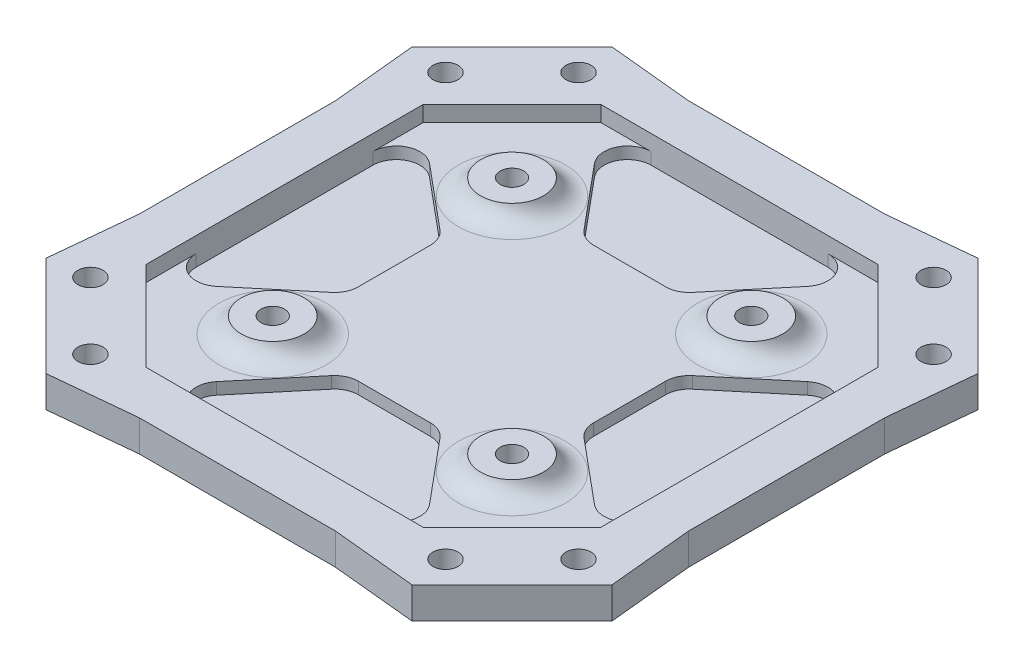
from build123d import *

# Parameters (mm, degrees)
BOSS_EXTRUDE1_DEPTH = 4
SKETCH2_R           = 1.6
CUT_EXTRUDE1_DEPTH  = 80.797158741
CUT_EXTRUDE2_DEPTH  = 2
CUT_EXTRUDE3_DEPTH  = 1.5
SKETCH5_R           = 4
BOSS_EXTRUDE3_DEPTH = 2
SKETCH6_R           = 1.5
CUT_EXTRUDE4_DEPTH  = 80.797158741
FILLET1_R           = 3


with BuildPart() as part:
    # Sketch1 → Boss-Extrude1 (new body)
    with BuildSketch(Plane(origin=(0, 0, 0), x_dir=(1, 0, 0), z_dir=(0, 1, 0))):
        Polygon((-12.5, 0), (12.5, 0), (23.338026386, 1.062677778), (36.065948447, -11.665244283), (35.003270669, -22.503270669), (35.003270669, -47.503270669), (36.065948447, -58.341297055), (23.338026386, -71.069219116), (12.5, -70.006541338), (-12.5, -70.006541338), (-23.338026386, -71.069219116), (-36.065948447, -58.341297055), (-35.003270669, -47.503270669), (-35.003270669, -22.503270669), (-36.065948447, -11.665244283), (-23.338026386, 1.062677778), align=None)
    extrude(amount=BOSS_EXTRUDE1_DEPTH)

    # Sketch2 → Cut-Extrude1 (cut, through all)
    with BuildSketch(Plane(origin=(0, 4, 0), x_dir=(1, 0, 0), z_dir=(0, 1, 0))):
        with Locations(Location((22.63, -3.893270669, 0), (0, 0, 270))):
            Circle(SKETCH2_R)
        with Locations(Location((31.11, -12.373270669, 0), (0, 0, 270))):
            Circle(SKETCH2_R)
        with Locations(Location((-31.11, -12.373270669, 0), (0, 0, 90))):
            Circle(SKETCH2_R)
        with Locations(Location((-22.63, -3.893270669, 0), (0, 0, 90))):
            Circle(SKETCH2_R)
        with Locations(Location((31.11, -57.633270669, 0), (0, 0, 90))):
            Circle(SKETCH2_R)
        with Locations(Location((22.63, -66.113270669, 0), (0, 0, 90))):
            Circle(SKETCH2_R)
        with Locations(Location((-22.63, -66.113270669, 0), (0, 0, 270))):
            Circle(SKETCH2_R)
        with Locations(Location((-31.11, -57.633270669, 0), (0, 0, 270))):
            Circle(SKETCH2_R)
    extrude(amount=-CUT_EXTRUDE1_DEPTH, mode=Mode.SUBTRACT)

    # Sketch3 → Cut-Extrude2 (cut)
    with BuildSketch(Plane(origin=(0, 4, 0), x_dir=(1, 0, 0), z_dir=(0, 1, 0))):
        Polygon((-17.672782103, -6), (17.672782103, -6), (29.003270669, -17.330488566), (29.003270669, -52.676052772), (17.672782103, -64.006541338), (-17.672782103, -64.006541338), (-29.003270669, -52.676052772), (-29.003270669, -17.330488566), align=None)
    extrude(amount=-CUT_EXTRUDE2_DEPTH, mode=Mode.SUBTRACT)

    # Sketch4 → Cut-Extrude3 (cut)
    with BuildSketch(Plane(origin=(0, 2, 0), x_dir=(1, 0, 0), z_dir=(0, 1, 0))):
        with BuildLine():
            Line((-4.595346553, -50.006541338), (4.595346553, -50.006541338))
            ThreePointArc((4.595346553, -50.006541338), (5.867462624, -50.289609115), (6.899515315, -51.085394202))
            Line((6.899515315, -51.085394202), (13.569676517, -59.085394202))
            ThreePointArc((13.569676517, -59.085394202), (13.982439977, -62.278657408), (11.265507754, -64.006541338))
            Line((11.265507754, -64.006541338), (-11.265507754, -64.006541338))
            ThreePointArc((-11.265507754, -64.006541338), (-13.982439977, -62.278657408), (-13.569676517, -59.085394202))
            Line((-13.569676517, -59.085394202), (-6.899515315, -51.085394202))
            ThreePointArc((-6.899515315, -51.085394202), (-5.867462624, -50.289609115), (-4.595346553, -50.006541338))
        make_face()
        with BuildLine():
            Line((-24.082123534, -48.572947186), (-16.082123534, -41.902785984))
            ThreePointArc((-16.082123534, -41.902785984), (-15.286338446, -40.870733292), (-15.003270669, -39.598617222))
            Line((-15.003270669, -39.598617222), (-15.003270669, -30.407924116))
            ThreePointArc((-15.003270669, -30.407924116), (-15.286338446, -29.135808045), (-16.082123534, -28.103755354))
            Line((-16.082123534, -28.103755354), (-24.082123534, -21.433594152))
            ThreePointArc((-24.082123534, -21.433594152), (-27.27538674, -21.020830692), (-29.003270669, -23.737762914))
            Line((-29.003270669, -23.737762914), (-29.003270669, -46.268778423))
            ThreePointArc((-29.003270669, -46.268778423), (-27.27538674, -48.985710646), (-24.082123534, -48.572947186))
        make_face()
        with BuildLine():
            Line((-13.569676517, -10.921147135), (-6.899515315, -18.921147135))
            ThreePointArc((-6.899515315, -18.921147135), (-5.867462624, -19.716932223), (-4.595346553, -20))
            Line((-4.595346553, -20), (4.595346553, -20))
            ThreePointArc((4.595346553, -20), (5.867462624, -19.716932223), (6.899515315, -18.921147135))
            Line((6.899515315, -18.921147135), (13.569676517, -10.921147135))
            ThreePointArc((13.569676517, -10.921147135), (13.982439977, -7.727883929), (11.265507754, -6))
            Line((11.265507754, -6), (-11.265507754, -6))
            ThreePointArc((-11.265507754, -6), (-13.982439977, -7.727883929), (-13.569676517, -10.921147135))
        make_face()
        with BuildLine():
            Line((24.082123534, -21.433594152), (16.082123534, -28.103755354))
            ThreePointArc((16.082123534, -28.103755354), (15.286338446, -29.135808045), (15.003270669, -30.407924116))
            Line((15.003270669, -30.407924116), (15.003270669, -39.598617222))
            ThreePointArc((15.003270669, -39.598617222), (15.286338446, -40.870733292), (16.082123534, -41.902785984))
            Line((16.082123534, -41.902785984), (24.082123534, -48.572947186))
            ThreePointArc((24.082123534, -48.572947186), (27.27538674, -48.985710646), (29.003270669, -46.268778423))
            Line((29.003270669, -46.268778423), (29.003270669, -23.737762914))
            ThreePointArc((29.003270669, -23.737762914), (27.27538674, -21.020830692), (24.082123534, -21.433594152))
        make_face()
    extrude(amount=-CUT_EXTRUDE3_DEPTH, mode=Mode.SUBTRACT)

    # Sketch5 → Boss-Extrude3 (add)
    with BuildSketch(Plane(origin=(0, 2, 0), x_dir=(1, 0, 0), z_dir=(0, 1, 0))):
        with Locations(Location((15.25, -19.753270669, 0), (0, 0, 90))):
            Circle(SKETCH5_R)
        with Locations(Location((-15.25, -19.753270669, 0), (0, 0, 90))):
            Circle(SKETCH5_R)
        with Locations(Location((-15.25, -50.253270669, 0), (0, 0, 90))):
            Circle(SKETCH5_R)
        with Locations(Location((15.25, -50.253270669, 0), (0, 0, 90))):
            Circle(SKETCH5_R)
    extrude(amount=BOSS_EXTRUDE3_DEPTH)

    # Sketch6 → Cut-Extrude4 (cut, through all)
    with BuildSketch(Plane(origin=(0, 4, 0), x_dir=(1, 0, 0), z_dir=(0, 1, 0))):
        with Locations(Location((15.25, -19.753270669, 0), (0, 0, 270))):
            Circle(SKETCH6_R)
        with Locations(Location((15.25, -50.253270669, 0), (0, 0, 270))):
            Circle(SKETCH6_R)
        with Locations(Location((-15.25, -50.253270669, 0), (0, 0, 270))):
            Circle(SKETCH6_R)
        with Locations(Location((-15.25, -19.753270669, 0), (0, 0, 270))):
            Circle(SKETCH6_R)
    extrude(amount=-CUT_EXTRUDE4_DEPTH, mode=Mode.SUBTRACT)

    # Fillet1
    # the kernel refuses this fillet: 3 mm, written as the material it adds along each edge
    with BuildSketch(Plane(origin=(15.25, 2, 19.753270669), x_dir=(0, 0, -1), z_dir=(1, 0, 0))) as fillet1_piece_1:
        with BuildLine():
            CenterArc((6.828427125, 3), FILLET1_R, 199.471220634, 70.528779366)
            Line((4, 2), (3.943431458, 1.98))
            ThreePointArc((3.943431458, 1.98), (3.94, 1), (3.94, 0))
            Line((3.94, 0), (4, -0.06))
            Line((4, -0.06), (6.828427125, -0.06))
            Line((6.828427125, -0.06), (6.828427125, 0))
        make_face()
    revolve(axis=Axis((15.25, 2, 19.753270669), (0, 1, 0)))
    with BuildSketch(Plane(origin=(-15.25, 2, 19.753270669), x_dir=(0, 0, -1), z_dir=(1, 0, 0))) as fillet1_piece_2:
        with BuildLine():
            CenterArc((6.828427125, 3), FILLET1_R, 199.471220634, 70.528779366)
            Line((4, 2), (3.943431458, 1.98))
            ThreePointArc((3.943431458, 1.98), (3.94, 1), (3.94, 0))
            Line((3.94, 0), (4, -0.06))
            Line((4, -0.06), (6.828427125, -0.06))
            Line((6.828427125, -0.06), (6.828427125, 0))
        make_face()
    revolve(axis=Axis((-15.25, 2, 19.753270669), (0, 1, 0)))
    with BuildSketch(Plane(origin=(-15.25, 2, 50.253270669), x_dir=(0, 0, -1), z_dir=(1, 0, 0))) as fillet1_piece_3:
        with BuildLine():
            CenterArc((6.828427125, 3), FILLET1_R, 199.471220634, 70.528779366)
            Line((4, 2), (3.943431458, 1.98))
            ThreePointArc((3.943431458, 1.98), (3.94, 1), (3.94, 0))
            Line((3.94, 0), (4, -0.06))
            Line((4, -0.06), (6.828427125, -0.06))
            Line((6.828427125, -0.06), (6.828427125, 0))
        make_face()
    revolve(axis=Axis((-15.25, 2, 50.253270669), (0, 1, 0)))
    with BuildSketch(Plane(origin=(15.25, 2, 50.253270669), x_dir=(0, 0, -1), z_dir=(1, 0, 0))) as fillet1_piece_4:
        with BuildLine():
            CenterArc((6.828427125, 3), FILLET1_R, 199.471220634, 70.528779366)
            Line((4, 2), (3.943431458, 1.98))
            ThreePointArc((3.943431458, 1.98), (3.94, 1), (3.94, 0))
            Line((3.94, 0), (4, -0.06))
            Line((4, -0.06), (6.828427125, -0.06))
            Line((6.828427125, -0.06), (6.828427125, 0))
        make_face()
    revolve(axis=Axis((15.25, 2, 50.253270669), (0, 1, 0)))


solid = part.part
